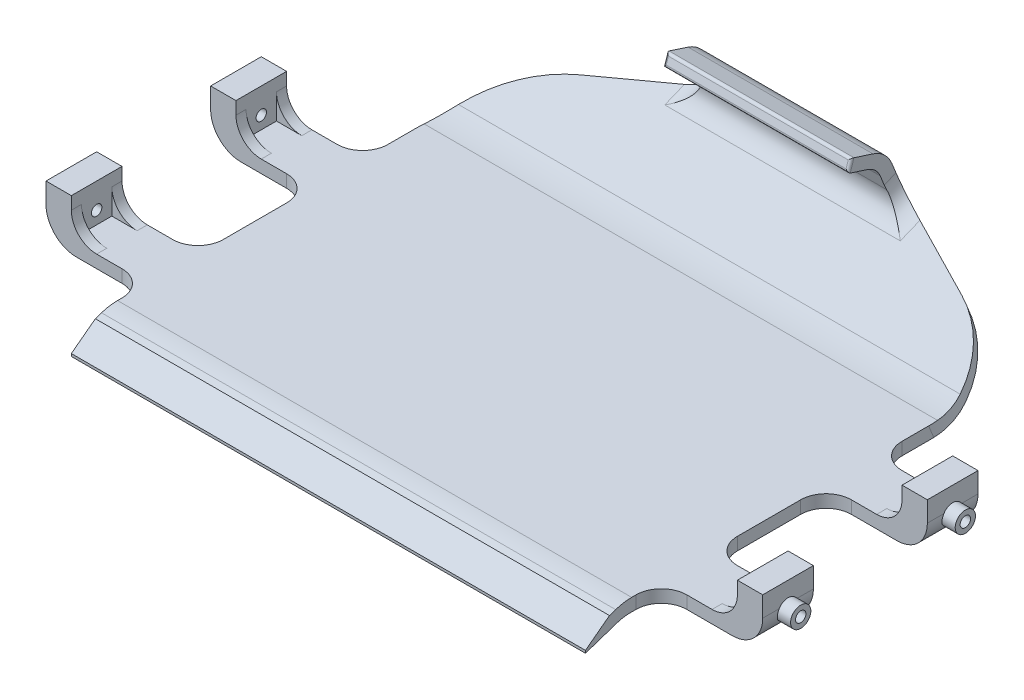
from build123d import *

# Parameters (mm, degrees)
BOSS_EXTRUDE1_DEPTH  = 5
BOSS_EXTRUDE2_DEPTH  = 5
BOSS_EXTRUDE3_DEPTH  = 15
SKETCH4_R            = 4.000000000000006
BOSS_EXTRUDE4_DEPTH  = 5
BOSS_EXTRUDE5_START  = 5
SKETCH6_R            = 4.000000000000006
BOSS_EXTRUDE5_DEPTH  = 5
SKETCH5_R            = 2.049999999999993
CUT_EXTRUDE1_DEPTH   = 322.1681802420657
FILLET1_R            = 10
FILLET2_R            = 10
FILLET3_R            = 12
BOSS_EXTRUDE8_DEPTH  = 203
FILLET5_R            = 30
FILLET6_R            = 45
CUT_EXTRUDE3_DEPTH   = 280.8804921769286
BOSS_EXTRUDE9_DEPTH  = 20
FILLET7_R            = 10
BOSS_EXTRUDE10_DEPTH = 73.00000000000004
FILLET8_R            = 8
FILLET9_R            = 8
FILLET10_R           = 12
FILLET11_R           = 12
FILLET12_R           = 1
SKETCH14_W           = 20
SKETCH14_H           = 12.000000000000071
SKETCH14_W_2         = 19.999999999999943
CUT_EXTRUDE4_DEPTH   = 14.999999999999982
FILLET13_R           = 45
BOSS_EXTRUDE11_DEPTH = 203
FILLET14_R           = 20
FILLET15_R           = 16
CUT_EXTRUDE6_DEPTH   = 203


with BuildPart() as part:
    # Sketch1 → Boss-Extrude1 (new body)
    with BuildSketch(Plane(origin=(0, 0, 0), x_dir=(1, 0, 0), z_dir=(0, 1, 0))):
        Polygon((0, 0), (203, 0), (203.00000000000003, -129.99999999999997), (0, -130), align=None)
    extrude(amount=BOSS_EXTRUDE1_DEPTH)

    # Sketch2 → Boss-Extrude2 (add)
    with BuildSketch(Plane(origin=(0, 5, 0), x_dir=(1, 0, 0), z_dir=(0, 1, 0))):
        Polygon((-1.821e-14, -30.000000000000032), (-2.082e-14, -50.00000000000003), (-40.00000000000002, -50.000000000000036), (-40.00000000000002, -30.000000000000036), align=None)
        Polygon((0, -95.00000000000003), (-39.99999999999999, -95.00000000000004), (-40, -115.00000000000004), (1.388e-14, -115.00000000000003), align=None)
        Polygon((243.00000000000009, -115.00000000000004), (203.00000000000006, -115.00000000000003), (203.00000000000006, -95.00000000000003), (243.00000000000006, -95.00000000000004), align=None)
        Polygon((243.0000000000001, -50.000000000000036), (243.0000000000001, -30.000000000000036), (203.00000000000006, -30.000000000000032), (203.00000000000009, -50.00000000000003), align=None)
    extrude(amount=-BOSS_EXTRUDE2_DEPTH)

    # Sketch3 → Boss-Extrude3 (add)
    with BuildSketch(Plane(origin=(0, 5, 0), x_dir=(1, 0, 0), z_dir=(0, 1, 0))):
        Polygon((-40.00000000000002, -30.000000000000036), (-40.00000000000002, -50.000000000000036), (-30.00000000000002, -50.000000000000036), (-30.00000000000002, -30.000000000000085), align=None)
        Polygon((-39.99999999999999, -95.00000000000004), (-40, -115.00000000000004), (-29.999999999999993, -115.00000000000004), (-29.999999999999993, -95.00000000000004), align=None)
        Polygon((233.00000000000006, -115.00000000000004), (233.00000000000006, -95.00000000000004), (243.00000000000006, -95.00000000000004), (243.00000000000009, -115.00000000000004), align=None)
        Polygon((233.00000000000009, -50.000000000000036), (233.00000000000009, -30.000000000000085), (243.0000000000001, -30.000000000000036), (243.0000000000001, -50.000000000000036), align=None)
    extrude(amount=BOSS_EXTRUDE3_DEPTH)

    # Sketch4 → Boss-Extrude4 (add)
    with BuildSketch(Plane.ZY.offset(40.00000000000002)):
        with Locations((40.000000000000036, 9.999999999999998)):
            Circle(SKETCH4_R)
        with Locations((105.00000000000004, 9.999999999999998)):
            Circle(SKETCH4_R)
    extrude(amount=BOSS_EXTRUDE4_DEPTH)

    # Sketch6 → Boss-Extrude5 (add)
    with BuildSketch(Plane(origin=(242.99999999999991, 0, -3.3723e-13), x_dir=(-1.39e-15, 0, -1), z_dir=(1, 0, -1.39e-15)).offset(BOSS_EXTRUDE5_START)):
        with Locations(Location((-105.00000000000037, 10, 0), (0, 0, 180))):
            Circle(SKETCH6_R)
        with Locations(Location((-40.00000000000037, 10, 0), (0, 0, 180))):
            Circle(SKETCH6_R)
    extrude(amount=-BOSS_EXTRUDE5_DEPTH)

    # Sketch5 → Cut-Extrude1 (cut, through all)
    with BuildSketch(Plane.ZY.offset(45.00000000000002)):
        with Locations((40.000000000000036, 9.999999999999998)):
            Circle(SKETCH5_R)
        with Locations((105.00000000000004, 9.999999999999998)):
            Circle(SKETCH5_R)
    extrude(amount=-CUT_EXTRUDE1_DEPTH, mode=Mode.SUBTRACT)

    # Fillet1
    fillet1_edges = [part.edges().sort_by_distance(p)[0] for p in [
        (-1.821e-14, 2.5, 30.000000000000032),
        (-2.082e-14, 2.5, 50.00000000000003),
        (0, 2.5, 95.00000000000003),
        (1.388e-14, 2.5, 115.00000000000003),
        (203.00000000000006, 2.5, 115.00000000000003),
        (203.00000000000006, 2.5, 95.00000000000003),
        (203.00000000000009, 2.5, 50.00000000000003),
        (203.00000000000006, 2.5, 30.000000000000032),
    ]]
    fillet(fillet1_edges, radius=FILLET1_R)

    # Fillet2
    # the kernel refuses this fillet: 10 mm, written as the material it adds along each edge
    with BuildSketch(Plane(origin=(233.00000000000009, 5, 50.000000000000036), x_dir=(-1, 0, 0), z_dir=(0, 0, -1))) as fillet2_piece_1_section:
        with BuildLine():
            CenterArc((FILLET2_R, FILLET2_R), FILLET2_R, 180, 90)
            Line((0, FILLET2_R), (0, 0))
            Line((0, 0), (FILLET2_R, 0))
        make_face()
    fillet2_piece_1 = extrude(amount=19.99999999999995, mode=Mode.PRIVATE)
    fillet2_piece_1 = fillet2_piece_1 - Plane(origin=(230.66860937265002, 9.999999999999998, 40.000000000000036), x_dir=(0, 0, 1), z_dir=(-1, 0, 0)) * Cylinder(2.049999999999993, 80, mode=Mode.PRIVATE)
    add(fillet2_piece_1)
    with BuildSketch(Plane(origin=(-30.00000000000002, 5, 50.000000000000036), x_dir=(1, 0, 0), z_dir=(0, 0, -1))) as fillet2_piece_2_section:
        with BuildLine():
            CenterArc((FILLET2_R, -FILLET2_R), FILLET2_R, 90, 90)
            Line((-7.11e-15, -FILLET2_R), (0, 0))
            Line((0, 0), (FILLET2_R, 0))
        make_face()
    fillet2_piece_2 = extrude(amount=19.99999999999995, mode=Mode.PRIVATE)
    fillet2_piece_2 = fillet2_piece_2 - Plane(origin=(-27.668609371285342, 9.999999999999998, 40.000000000000036), x_dir=(0, 0, 1), z_dir=(-1, 0, 0)) * Cylinder(2.049999999999993, 80, mode=Mode.PRIVATE)
    add(fillet2_piece_2)
    with BuildSketch(Plane(origin=(-29.999999999999993, 5, 115.00000000000004), x_dir=(1, 0, 0), z_dir=(0, 0, -1))) as fillet2_piece_3_section:
        with BuildLine():
            CenterArc((FILLET2_R, -FILLET2_R), FILLET2_R, 90, 90)
            Line((-7.11e-15, -FILLET2_R), (0, 0))
            Line((0, 0), (FILLET2_R, 0))
        make_face()
    fillet2_piece_3 = extrude(amount=20, mode=Mode.PRIVATE)
    fillet2_piece_3 = fillet2_piece_3 - Plane(origin=(-27.668609372640347, 9.999999999999998, 105.00000000000004), x_dir=(0, 0, 1), z_dir=(-1, 0, 0)) * Cylinder(2.049999999999993, 80, mode=Mode.PRIVATE)
    add(fillet2_piece_3)
    with BuildSketch(Plane(origin=(233.00000000000006, 5, 115.00000000000004), x_dir=(-1, 0, 0), z_dir=(0, 0, -1))) as fillet2_piece_4_section:
        with BuildLine():
            CenterArc((FILLET2_R, FILLET2_R), FILLET2_R, 180, 90)
            Line((0, FILLET2_R), (0, 0))
            Line((0, 0), (FILLET2_R, 0))
        make_face()
    fillet2_piece_4 = extrude(amount=20, mode=Mode.PRIVATE)
    fillet2_piece_4 = fillet2_piece_4 - Plane(origin=(230.66860937134575, 9.999999999999998, 105.00000000000004), x_dir=(0, 0, 1), z_dir=(-1, 0, 0)) * Cylinder(2.049999999999993, 80, mode=Mode.PRIVATE)
    add(fillet2_piece_4)

    # Fillet3
    # the kernel refuses this fillet: 12 mm, written as the material it takes off along each edge
    with BuildSketch(Plane(origin=(-40.00000000000003, 0, 80.00000000000003), x_dir=(1, 0, 0), z_dir=(0, 0, -1))) as fillet3_piece_1_section:
        with BuildLine():
            CenterArc((FILLET3_R, -FILLET3_R), FILLET3_R, 90, 90)
            Line((0, -FILLET3_R), (0, 0))
            Line((0, 0), (FILLET3_R, 0))
        make_face()
    fillet3_piece_1 = extrude(amount=80, mode=Mode.PRIVATE)
    fillet3_piece_1 = fillet3_piece_1 - Plane(origin=(-37.255421783652096, 9.999999999999998, 40.000000000000036), x_dir=(0, 0, 1), z_dir=(1, 0, 0)) * Cylinder(4.000000000000006, 208, mode=Mode.PRIVATE)
    add(fillet3_piece_1, mode=Mode.SUBTRACT)
    with BuildSketch(Plane(origin=(-39.99999999999997, 0, 65.00000000000004), x_dir=(1, 0, 3.6e-16), z_dir=(-3.6e-16, 0, 1))) as fillet3_piece_2_section:
        with BuildLine():
            CenterArc((FILLET3_R, FILLET3_R), FILLET3_R, 180, 90)
            Line((0, FILLET3_R), (0, 0))
            Line((0, 0), (FILLET3_R, 0))
        make_face()
    fillet3_piece_2 = extrude(amount=80.00000000000001, mode=Mode.PRIVATE)
    fillet3_piece_2 = fillet3_piece_2 - Plane(origin=(-37.25542178375064, 9.999999999999998, 105.00000000000004), x_dir=(0, 0, 1), z_dir=(1, 0, 0)) * Cylinder(4.000000000000006, 209, mode=Mode.PRIVATE)
    add(fillet3_piece_2, mode=Mode.SUBTRACT)
    with BuildSketch(Plane(origin=(243, 0, 65.00000000000004), x_dir=(0, 1, 0), z_dir=(1.42e-15, 0, 1))) as fillet3_piece_3_section:
        with BuildLine():
            CenterArc((FILLET3_R, FILLET3_R), FILLET3_R, 180, 90)
            Line((-1.78e-15, FILLET3_R), (0, 0))
            Line((0, 0), (FILLET3_R, 0))
        make_face()
    fillet3_piece_3 = extrude(amount=80.00000000000001, mode=Mode.PRIVATE)
    fillet3_piece_3 = fillet3_piece_3 - Plane(origin=(240.25542352872853, 10, 105.00000000000004), x_dir=(1.39e-15, 1.2e-16, 1), z_dir=(1, 0, -1.39e-15)) * Cylinder(4.000000000000006, 209, mode=Mode.PRIVATE)
    add(fillet3_piece_3, mode=Mode.SUBTRACT)
    with BuildSketch(Plane(origin=(243.0000000000001, 0, 80.00000000000003), x_dir=(-1, 0, 0), z_dir=(0, 0, -1))) as fillet3_piece_4_section:
        with BuildLine():
            CenterArc((FILLET3_R, FILLET3_R), FILLET3_R, 180, 90)
            Line((0, FILLET3_R), (0, 0))
            Line((0, 0), (FILLET3_R, 0))
        make_face()
    fillet3_piece_4 = extrude(amount=80, mode=Mode.PRIVATE)
    fillet3_piece_4 = fillet3_piece_4 - Plane(origin=(240.25542452189814, 10, 40.00000000000004), x_dir=(1.39e-15, 1.2e-16, 1), z_dir=(1, 0, -1.39e-15)) * Cylinder(4.000000000000006, 208, mode=Mode.PRIVATE)
    add(fillet3_piece_4, mode=Mode.SUBTRACT)

    # Sketch10 → Boss-Extrude8 (add)
    with BuildSketch(Plane.ZY):
        Polygon((0, 0), (-48.09583865448697, 19.431980169948663), (-46.359192728339494, 23.730329670795307), (0, 5), align=None)
    extrude(amount=-BOSS_EXTRUDE8_DEPTH)

    # Fillet5
    fillet5_edges = [part.edges().sort_by_distance(p)[0] for p in [
        (101.5, 5, 0),
    ]]
    fillet(fillet5_edges, radius=FILLET5_R)

    # Fillet6
    fillet6_edges = [part.edges().sort_by_distance(p)[0] for p in [
        (101.5, 0, 0),
    ]]
    fillet(fillet6_edges, radius=FILLET6_R)

    # Sketch11 → Cut-Extrude3 (cut, through all)
    with BuildSketch(Plane(origin=(0, 4.298349500846653, 1.736645926147471), x_dir=(1, 0, 0), z_dir=(0, 0.9271838545667899, 0.374606593415906))):
        Polygon((0, 21.873032967079542), (65, 51.873032967079546), (0, 51.87303296707954), align=None)
        Polygon((138, 51.87303296707955), (203, 51.87303296707954), (203, 21.873032967079567), align=None)
    extrude(amount=-CUT_EXTRUDE3_DEPTH, mode=Mode.SUBTRACT)

    # Sketch12 → Boss-Extrude9 (add)
    with BuildSketch(Plane(origin=(0, 4.298349500846653, 1.736645926147471), x_dir=(1, 0, 0), z_dir=(0, 0.9271838545667899, 0.374606593415906))):
        Polygon((65, 51.87303296707955), (65, 46.873032967079546), (138.00000000000003, 46.873032967079546), (138.00000000000003, 51.87303296707954), align=None)
    extrude(amount=BOSS_EXTRUDE9_DEPTH)

    # Fillet7
    fillet7_edges = [part.edges().sort_by_distance(p)[0] for p in [
        (65, 22.793813187255545, -44.041233091922535),
        (138.00000000000003, 22.793813187255545, -44.04123309192252),
    ]]
    fillet(fillet7_edges, radius=FILLET7_R)

    # Sketch13 → Boss-Extrude10 (add)
    with BuildSketch(Plane.ZY.offset(-65)):
        Polygon((-38.8670608600214, 42.27400676213111), (-34.23114158718744, 40.40097379505157), (-34.980354774019254, 38.54660608591799), (-23.61013839516719, 42.241013337837174), (-25.076741373741726, 46.754753180568024), align=None)
    extrude(amount=-BOSS_EXTRUDE10_DEPTH)

    # Fillet8
    fillet8_edges = [part.edges().sort_by_distance(p)[0] for p in [
        (101.50000000000001, 21.857296703715782, -41.72327345550556),
    ]]
    fillet(fillet8_edges, radius=FILLET8_R)

    # Fillet9
    fillet9_edges = [part.edges().sort_by_distance(p)[0] for p in [
        (101.50000000000003, 38.54660608591799, -34.980354774019254),
    ]]
    fillet(fillet9_edges, radius=FILLET9_R)

    # Fillet10
    fillet10_edges = [part.edges().sort_by_distance(p)[0] for p in [
        (101.5, 19.431980169948663, -48.09583865448697),
    ]]
    fillet(fillet10_edges, radius=FILLET10_R)

    # Fillet11
    fillet11_edges = [part.edges().sort_by_distance(p)[0] for p in [
        (101.50000000000001, 42.27400676213111, -38.86706086002138),
    ]]
    fillet(fillet11_edges, radius=FILLET11_R)

    # Fillet12
    fillet12_edges = [part.edges().sort_by_distance(p)[0] for p in [
        (138.00000000000006, 44.497883259202595, -24.343439884454458),
        (101.50000000000003, 46.754753180568024, -25.076741373741726),
        (101.50000000000003, 42.241013337837174, -23.61013839516719),
        (65, 44.497883259202595, -24.343439884454458),
    ]]
    fillet(fillet12_edges, radius=FILLET12_R)

    # Sketch14 → Cut-Extrude4 (cut)
    with BuildSketch(Plane(origin=(0, 20, 0), x_dir=(1, 0, 0), z_dir=(0, 1, 0))):
        with Locations((-20.00000000000002, -40.000000000000064)):
            Rectangle(SKETCH14_W, SKETCH14_H)
        with Locations((-20.00000000000002, -105)):
            Rectangle(SKETCH14_W, SKETCH14_H)
        with Locations((223.00000000000006, -105)):
            Rectangle(SKETCH14_W_2, SKETCH14_H)
        with Locations((223.00000000000006, -40.000000000000064)):
            Rectangle(SKETCH14_W_2, SKETCH14_H)
    extrude(amount=-CUT_EXTRUDE4_DEPTH, mode=Mode.SUBTRACT)

    # Fillet13
    fillet13_edges = [part.edges().sort_by_distance(p)[0] for p in [
        (0, 10.342957117894803, -19.412000054409543),
        (203, 10.342957117894812, -19.412000054409564),
    ]]
    fillet(fillet13_edges, radius=FILLET13_R)

    # Sketch15 → Boss-Extrude11 (add)
    with BuildSketch(Plane.ZY):
        Polygon((130, 5), (145.00000000000003, 0), (145.00000000000003, -5.000000000000001), (130, 0), align=None)
    extrude(amount=-BOSS_EXTRUDE11_DEPTH)

    # Fillet14
    fillet14_edges = [part.edges().sort_by_distance(p)[0] for p in [
        (101.50000000000001, 5, 130),
    ]]
    fillet(fillet14_edges, radius=FILLET14_R)

    # Fillet15
    fillet15_edges = [part.edges().sort_by_distance(p)[0] for p in [
        (101.50000000000001, 0, 130),
    ]]
    fillet(fillet15_edges, radius=FILLET15_R)

    # Sketch17 → Cut-Extrude6 (cut)
    with BuildSketch(Plane.ZY):
        Polygon((145.00000000000003, -4), (135.51316701949486, 3.162277660168378), (145.00000000000003, 0), align=None)
    extrude(amount=-CUT_EXTRUDE6_DEPTH, mode=Mode.SUBTRACT)


solid = part.part
